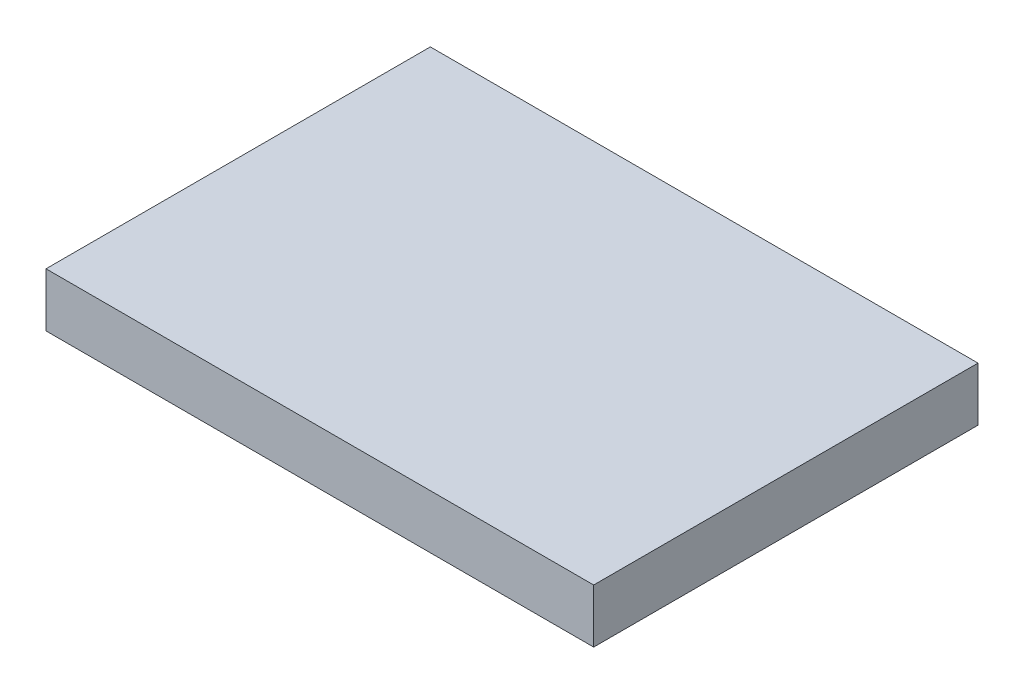
from build123d import *

# Parameters (mm, degrees)
SKIZZE1_W                       = 200
SKIZZE1_H                       = 28
AUFSATZ_LINEAR_AUSTRAGEN1_DEPTH = 142.5


with BuildPart() as part:
    # Skizze1 → Aufsatz-Linear austragen1 (new, symmetric)
    with BuildSketch(Plane(origin=(0, 0, 0), x_dir=(0, 0, -1), z_dir=(1, 0, 0))):
        Rectangle(SKIZZE1_W, SKIZZE1_H)
    extrude(amount=AUFSATZ_LINEAR_AUSTRAGEN1_DEPTH, both=True)


solid = part.part
